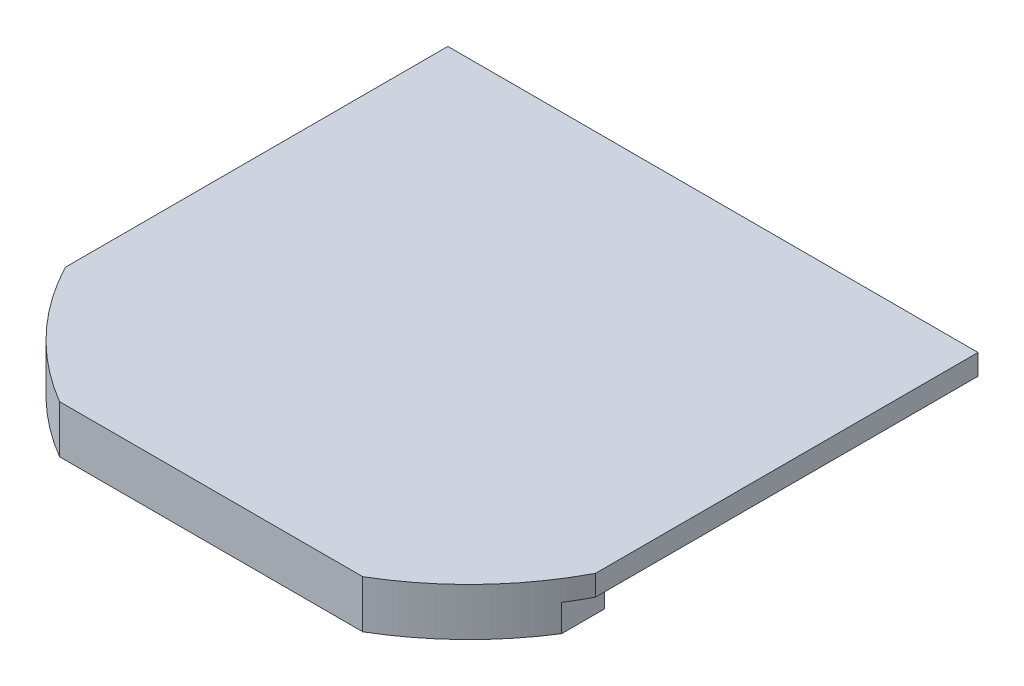
from build123d import *

# Parameters (mm, degrees)
STOCK_COMPARTMENT_START            = 0.33
STOCK_COMPARTMENT_BOTTOM_1_DEPTH   = 2
STOCK_COMPARTMENT_START_2          = -2.3
STOCK_COMPARTMENT_BOTTOM_1_2_DEPTH = 2.63
BOSS_EXTRUDE1_START                = -2
BOSS_EXTRUDE1_DEPTH                = 2


# Read off the part's stored shape, not the designer's step: Stock-Compartment Bottom-1
with BuildPart() as part:
    # Stock-Compartment Bottom-1 outline → Stock-Compartment Bottom-1 (new body)
    with BuildSketch(Plane(origin=(0, 0, 0), x_dir=(1, 0, 0), z_dir=(0, 1, 0)).offset(STOCK_COMPARTMENT_START)):
        with BuildLine():
            Line((24.5, -5.716120649), (24.5, 8.453194282))
            Line((24.5, 8.453194282), (-24.5, 8.453194282))
            Line((-24.5, 8.453194282), (-24.5, -5.716120649))
            ThreePointArc((-24.5, -5.716120649), (-20.163977484, -11.042600894), (-14.696938457, -15.2))
            Line((-14.696938457, -15.2), (14.696938457, -15.2))
            ThreePointArc((14.696938457, -15.2), (20.163977484, -11.042600894), (24.5, -5.716120649))
        make_face()
    extrude(amount=STOCK_COMPARTMENT_BOTTOM_1_DEPTH)

    # Stock-Compartment Bottom-1 2 outline → Stock-Compartment Bottom-1 2 (add)
    with BuildSketch(Plane(origin=(0, 0, 0), x_dir=(1, 0, 0), z_dir=(0, 1, 0)).offset(STOCK_COMPARTMENT_START_2)):
        with BuildLine():
            Line((24.5, -5.716120649), (24.5, -1.546805718))
            ThreePointArc((24.5, -1.546805718), (20.180507814, -8.137310399), (14.142135624, -13.2))
            Line((14.142135624, -13.2), (-14.142135624, -13.2))
            ThreePointArc((-14.142135624, -13.2), (-20.180507814, -8.137310399), (-24.5, -1.546805718))
            Line((-24.5, -1.546805718), (-24.5, -5.716120649))
            ThreePointArc((-24.5, -5.716120649), (-20.163977484, -11.042600894), (-14.696938457, -15.2))
            Line((-14.696938457, -15.2), (14.696938457, -15.2))
            ThreePointArc((14.696938457, -15.2), (20.163977484, -11.042600894), (24.5, -5.716120649))
        make_face()
    extrude(amount=STOCK_COMPARTMENT_BOTTOM_1_2_DEPTH)

    # Sketch1 → Boss-Extrude1 (add)
    with BuildSketch(Plane(origin=(0, 2.33, 0), x_dir=(1, 0, 0), z_dir=(0, 1, 0)).offset(BOSS_EXTRUDE1_START)):
        with BuildLine():
            Line((-25.7, 33.453194282), (-25.7, 8.453194282))
            Line((-25.7, 8.453194282), (-25.7, -3.635400999))
            ThreePointArc((-25.7, -3.635400999), (-25.121551476, -4.688190068), (-24.5, -5.716120649))
            Line((-24.5, -5.716120649), (-24.5, 8.453194282))
            Line((-24.5, 8.453194282), (24.5, 8.453194282))
            Line((24.5, 8.453194282), (24.5, -5.716120649))
            ThreePointArc((24.5, -5.716120649), (25.121551476, -4.688190068), (25.7, -3.635400999))
            Line((25.7, -3.635400999), (25.7, 8.453194282))
            Line((25.7, 8.453194282), (25.7, 33.453194282))
            Line((25.7, 33.453194282), (-25.7, 33.453194282))
        make_face()
    extrude(amount=BOSS_EXTRUDE1_DEPTH)


solid = part.part
